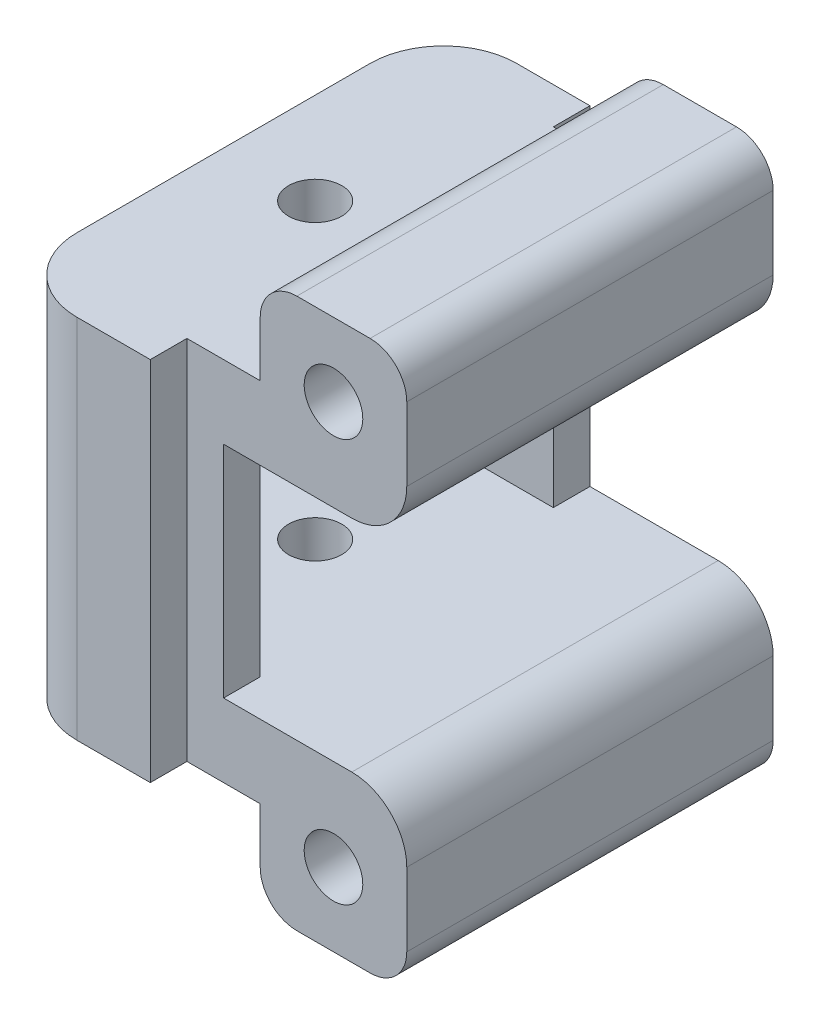
from build123d import *

# Parameters (mm, degrees)
SKETCH1_W           = 20
SKETCH1_H           = 20
BOSS_EXTRUDE1_DEPTH = 4
SKETCH2_R           = 3.7
CUT_EXTRUDE1_DEPTH  = 2.6
SKETCH3_R           = 2.1
CUT_EXTRUDE2_DEPTH  = 29.403520909
SKETCH4_W           = 12
SKETCH4_H           = 4
BOSS_EXTRUDE2_DEPTH = 12
SKETCH7_W           = 20
SKETCH7_H           = 4
BOSS_EXTRUDE3_DEPTH = 10
SKETCH8_W           = 8
SKETCH8_H           = 20
BOSS_EXTRUDE4_DEPTH = 5
SKETCH9_W           = 8
SKETCH9_H           = 20
BOSS_EXTRUDE5_DEPTH = 5
SKETCH10_R          = 1.6
CUT_EXTRUDE5_DEPTH  = 42.243181255
SKETCH11_W          = 30
SKETCH11_H          = 30
CUT_EXTRUDE6_DEPTH  = 6
SKETCH12_R          = 1.45
CUT_EXTRUDE7_DEPTH  = 42.243181255
SKETCH13_W          = 8
SKETCH13_H          = 20
BOSS_EXTRUDE6_DEPTH = 2
SKETCH14_W          = 8
SKETCH14_H          = 20
BOSS_EXTRUDE7_DEPTH = 2
SKETCH15_W          = 16
SKETCH15_H          = 12
CUT_EXTRUDE8_DEPTH  = 39.845849199
FILLET2_R           = 3
FILLET4_R           = 2
FILLET5_START       = -21
FILLET5_DEPTH       = 22


with BuildPart() as part:
    # Sketch1 → Boss-Extrude1 (new body)
    with BuildSketch(Plane(origin=(0, 0, 0), x_dir=(0, 0, -1), z_dir=(1, 0, 0))):
        with Locations((-10, -10)):
            Rectangle(SKETCH1_W, SKETCH1_H)
    extrude(amount=BOSS_EXTRUDE1_DEPTH)

    # Sketch2 → Cut-Extrude1 (cut)
    with BuildSketch(Plane(origin=(4, 0, 0), x_dir=(0, 0, -1), z_dir=(1, 0, 0))):
        with Locations((-10, -10)):
            Circle(SKETCH2_R)
    extrude(amount=-CUT_EXTRUDE1_DEPTH, mode=Mode.SUBTRACT)

    # Sketch3 → Cut-Extrude2 (cut, through all)
    with BuildSketch(Plane(origin=(1.4, 0, 0), x_dir=(0, 0, -1), z_dir=(1, 0, 0))):
        with Locations((-10, -10)):
            Circle(SKETCH3_R)
    extrude(amount=-CUT_EXTRUDE2_DEPTH, mode=Mode.SUBTRACT)

    # Sketch4 → Boss-Extrude2 (add)
    with BuildSketch(Plane(origin=(4, 0, 0), x_dir=(0, 0, -1), z_dir=(1, 0, 0))):
        Polygon((-20, 0), (-20, -20), (-16, -20), (-16, -16), (-16, -4), (-16, 0), align=None)
        with Locations((-10, -18)):
            Rectangle(SKETCH4_W, SKETCH4_H)
        Polygon((-4, -16), (-4, -20), (0, -20), (0, -4), (-4, -4), align=None)
        Polygon((0, 0), (-16, 0), (-16, -4), (-4, -4), (0, -4), align=None)
    extrude(amount=BOSS_EXTRUDE2_DEPTH)

    # Sketch7 → Boss-Extrude3 (add)
    with BuildSketch(Plane(origin=(16, 0, 0), x_dir=(0, 0, -1), z_dir=(1, 0, 0))):
        with Locations((-10, -18)):
            Rectangle(SKETCH7_W, SKETCH7_H)
        with Locations((-10, -2)):
            Rectangle(SKETCH7_W, SKETCH7_H)
    extrude(amount=BOSS_EXTRUDE3_DEPTH)

    # Sketch8 → Boss-Extrude4 (add)
    with BuildSketch(Plane(origin=(0, -20, 0), x_dir=(-1, 0, 0), z_dir=(0, -1, 0))):
        with Locations((-22, -10)):
            Rectangle(SKETCH8_W, SKETCH8_H)
    extrude(amount=BOSS_EXTRUDE4_DEPTH)

    # Sketch9 → Boss-Extrude5 (add)
    with BuildSketch(Plane(origin=(0, 0, 0), x_dir=(1, 0, 0), z_dir=(0, 1, 0))):
        with Locations((22, -10)):
            Rectangle(SKETCH9_W, SKETCH9_H)
    extrude(amount=BOSS_EXTRUDE5_DEPTH)

    # Sketch10 → Cut-Extrude5 (cut, through all)
    with BuildSketch(Plane(origin=(0, 0, 0), x_dir=(-1, 0, 0), z_dir=(0, 0, -1))):
        with Locations(Location((-22, 1, 0), (0, 0, 90))):
            Circle(SKETCH10_R)
        with Locations(Location((-22, -21, 0), (0, 0, 90))):
            Circle(SKETCH10_R)
    extrude(amount=-CUT_EXTRUDE5_DEPTH, mode=Mode.SUBTRACT)

    # Sketch11 → Cut-Extrude6 (cut)
    with BuildSketch(Plane.ZY):
        with Locations((15, -5)):
            Rectangle(SKETCH11_W, SKETCH11_H)
    extrude(amount=-CUT_EXTRUDE6_DEPTH, mode=Mode.SUBTRACT)

    # Sketch12 → Cut-Extrude7 (cut, through all)
    with BuildSketch(Plane(origin=(0, 0, 0), x_dir=(1, 0, 0), z_dir=(0, 1, 0))):
        with Locations(Location((11, -10, 0), (0, 0, 270))):
            Circle(SKETCH12_R)
    extrude(amount=-CUT_EXTRUDE7_DEPTH, mode=Mode.SUBTRACT)

    # Sketch13 → Boss-Extrude6 (add)
    with BuildSketch(Plane.XY.offset(20)):
        with Locations((10, -10)):
            Rectangle(SKETCH13_W, SKETCH13_H)
    extrude(amount=BOSS_EXTRUDE6_DEPTH)

    # Sketch14 → Boss-Extrude7 (add)
    with BuildSketch(Plane(origin=(0, 0, 0), x_dir=(-1, 0, 0), z_dir=(0, 0, -1))):
        with Locations((-10, -10)):
            Rectangle(SKETCH14_W, SKETCH14_H)
    extrude(amount=BOSS_EXTRUDE7_DEPTH)

    # Sketch15 → Cut-Extrude8 (cut, through all)
    with BuildSketch(Plane.ZY.offset(-6)):
        with Locations((10, -10)):
            Rectangle(SKETCH15_W, SKETCH15_H)
    extrude(amount=-CUT_EXTRUDE8_DEPTH, mode=Mode.SUBTRACT)

    # Fillet2
    fillet2_edges = [part.edges().sort_by_distance(p)[0] for p in [
        (26, -16, 10),
        (26, -4, 10),
    ]]
    fillet(fillet2_edges, radius=FILLET2_R)

    # Fillet4
    fillet4_edges = [part.edges().sort_by_distance(p)[0] for p in [
        (26, -25, 10),
        (18, -25, 10),
        (26, 5, 10),
        (18, 5, 10),
    ]]
    fillet(fillet4_edges, radius=FILLET4_R)

    # Fillet5: read off the stored shape, not the designer's step
    # Fillet5 outline → Fillet5 (cut)
    with BuildSketch(Plane(origin=(0, 0, 0), x_dir=(1, 0, 0), z_dir=(0, 1, 0)).offset(FILLET5_START)):
        with BuildLine():
            Line((6, 2), (6, -2))
            ThreePointArc((6, -2), (7.171572875, 0.828427125), (10, 2))
            Line((10, 2), (6, 2))
        make_face()
        with BuildLine():
            ThreePointArc((10, -22), (7.171572875, -20.828427125), (6, -18))
            Line((6, -18), (6, -22))
            Line((6, -22), (10, -22))
        make_face()
    extrude(amount=FILLET5_DEPTH, mode=Mode.SUBTRACT)


solid = part.part
